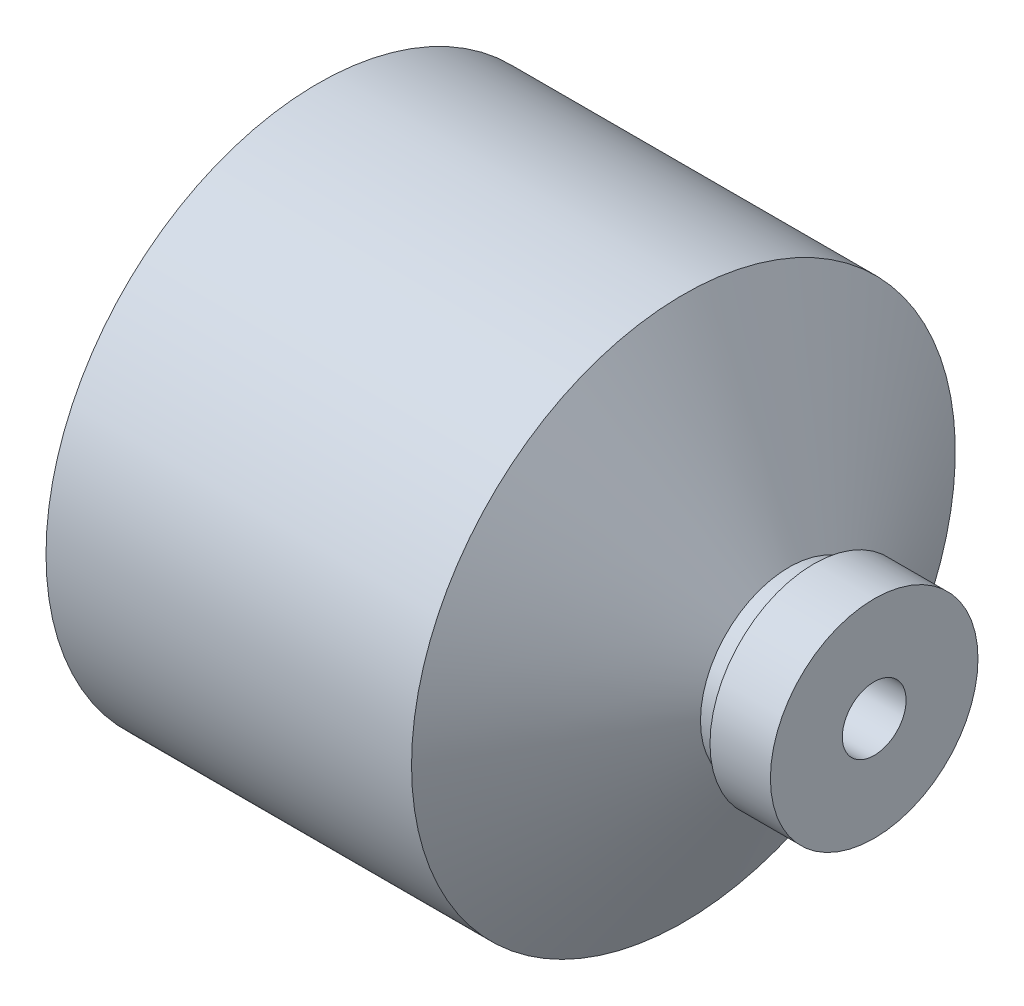
from build123d import *


with BuildPart() as part:
    # Sketch1 → Revolve1 (revolve)
    with BuildSketch(Plane(origin=(0, 0, 0), x_dir=(1, 0, 0), z_dir=(0, 1, 0))):
        Polygon((-73.661954618, 36), (-25.262429889, 36), (-11.25804845, 11.743699818), (-9.154700538, 11.743699818), (-8, 13.743699818), (0, 13.743699818), (0, 4.225), (-9.8, 4.225), (-11.661954618, 1), (-13.661954618, 1), (-13.661954618, 1.6), (-23.661954618, 1.6), (-23.661954618, 24.75), (-32.661954618, 33.75), (-73.661954618, 33.75), align=None)
    revolve(axis=Axis((-73.661954618, 0, 0), (1, 0, 0)))


solid = part.part
